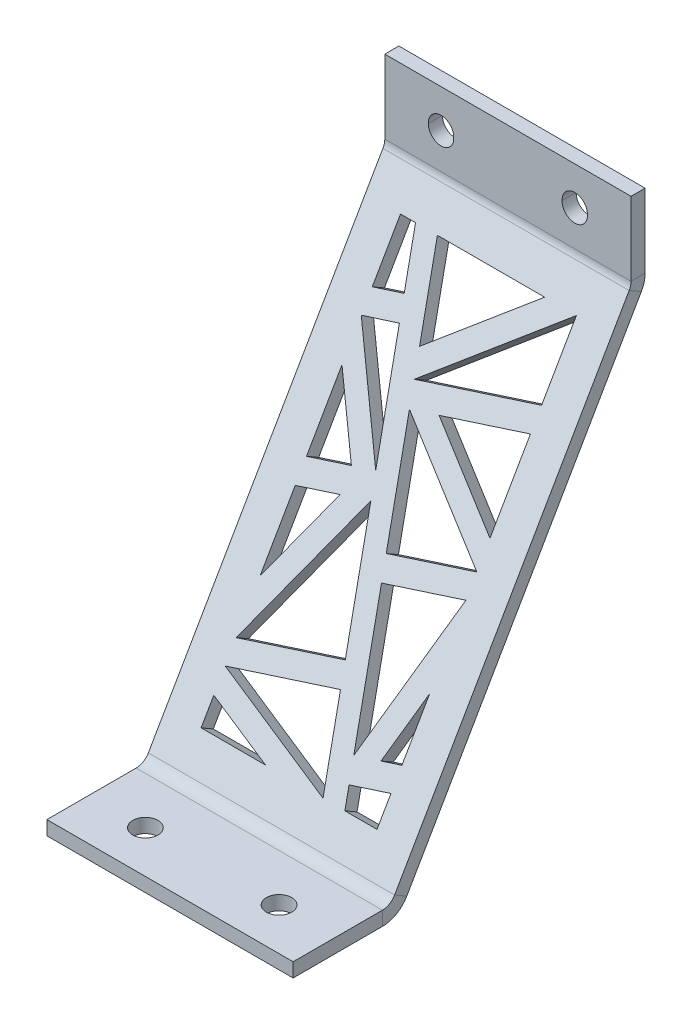
from build123d import *

# Parameters (mm, degrees)
SKETCH1_W            = 35
SKETCH1_H            = 15
BASE_FLANGE1_DEPTH   = 2
EDGE_FLANGE1_START   = -17.5
EDGE_FLANGE1_DEPTH   = 35
EDGE_FLANGE1_2_DEPTH = 35
EDGE_FLANGE2_START   = -17.5
EDGE_FLANGE2_DEPTH   = 35
EDGE_FLANGE2_2_DEPTH = 35
SKETCH8_W            = 25
SKETCH8_H            = 56.677305051
CUT_EXTRUDE1_DEPTH   = 10
BOSS_EXTRUDE1_DEPTH  = 2
BOSS_EXTRUDE2_DEPTH  = 2
M3_CLEARANCE_HOLE1_D = 3.6
M3_CLEARANCE_HOLE2_D = 3.6
M3_CLEARANCE_HOLE3_D = 3.6
M3_CLEARANCE_HOLE4_D = 3.6


# Read off the part's stored shape, not the designer's step: Edge-Flange1, Edge-Flange2
# Sheet-metal steps are written as plain solids
with BuildPart() as part:
    # Sketch1 → Base-Flange1 (new body)
    with BuildSketch(Plane.XY):
        Rectangle(SKETCH1_W, SKETCH1_H)
    extrude(amount=-BASE_FLANGE1_DEPTH)

    # Edge-Flange1 outline → Edge-Flange1 (cut)
    with BuildSketch(Plane.YZ.offset(EDGE_FLANGE1_START)):
        with BuildLine():
            ThreePointArc((-2.964101615, -2), (-3.999377795, -1.863703305), (-4.964101615, -1.464101615))
            Line((-4.964101615, -1.464101615), (-7.5, 0))
            Line((-7.5, 0), (-7.5, -2))
            Line((-7.5, -2), (-2.964101615, -2))
        make_face()
    extrude(amount=EDGE_FLANGE1_DEPTH, mode=Mode.SUBTRACT)

    # Edge-Flange1 2 outline → Edge-Flange1 2 (add)
    with BuildSketch(Plane.YZ.offset(EDGE_FLANGE1_START)):
        with BuildLine():
            Line((-65.708341645, 33.606601718), (-7.5, 0))
            Line((-7.5, 0), (-2.964101615, 0))
            ThreePointArc((-2.964101615, 0), (-3.481739705, 0.068148347), (-3.964101615, 0.267949192))
            Line((-3.964101615, 0.267949192), (-64.708341645, 35.338652525))
            Line((-64.708341645, 35.338652525), (-65.708341645, 33.606601718))
        make_face()
    extrude(amount=EDGE_FLANGE1_2_DEPTH)

    # Edge-Flange2 outline → Edge-Flange2 (cut)
    with BuildSketch(Plane.YZ.offset(EDGE_FLANGE2_START)):
        with BuildLine():
            ThreePointArc((-62.708341645, 31.87455091), (-64.17244326, 33.338652525), (-64.708341645, 35.338652525))
            Line((-64.708341645, 35.338652525), (-65.708341645, 33.606601718))
            Line((-65.708341645, 33.606601718), (-62.708341645, 31.87455091))
        make_face()
    extrude(amount=EDGE_FLANGE2_DEPTH, mode=Mode.SUBTRACT)

    # Edge-Flange2 2 outline → Edge-Flange2 2 (add)
    with BuildSketch(Plane.YZ.offset(EDGE_FLANGE2_START)):
        with BuildLine():
            Line((-64.708341645, 48.029251449), (-64.708341645, 35.338652525))
            Line((-64.708341645, 35.338652525), (-61.708341645, 33.606601718))
            ThreePointArc((-61.708341645, 33.606601718), (-62.440392453, 34.338652525), (-62.708341645, 35.338652525))
            Line((-62.708341645, 35.338652525), (-62.708341645, 48.029251449))
            Line((-62.708341645, 48.029251449), (-64.708341645, 48.029251449))
        make_face()
    extrude(amount=EDGE_FLANGE2_2_DEPTH)

    # Sketch8 → Cut-Extrude1 (cut)
    with BuildSketch(Plane(origin=(0, -0.875, -1.515544457), x_dir=(1, 0, 0), z_dir=(0, 0.499999999999995, 0.8660254037844416))):
        with Locations((0, -36.905639824)):
            Rectangle(SKETCH8_W, SKETCH8_H)
    extrude(amount=-CUT_EXTRUDE1_DEPTH, mode=Mode.SUBTRACT)

    # Sketch9 → Boss-Extrude1 (add)
    with BuildSketch(Plane(origin=(0, -0.875, -1.515544457), x_dir=(1, 0, 0), z_dir=(0, 0.499999999999995, 0.8660254037844416))):
        Polygon((8.83956854, -68.632858088), (7.246458748, -62.687291403), (15.857586038, -60.3799468), (15.081128903, -57.482169321), (6.470001613, -59.789513924), (1.919269462, -42.805950327), (15.365688048, -39.202993325), (14.946719777, -36.202993325), (1.14120391, -39.902170153), (-2.665166674, -25.696601742), (16.123001013, -20.662327383), (15.50761088, -17.662327383), (-3.456389996, -22.743716103), (-8.33426209, -4.539249615), (-11.232039569, -5.31570675), (-8.495960417, -15.52689316), (-17.05592393, -17.82052847), (-16.279466794, -20.718305949), (-7.708625485, -18.465267128), (-3.822054178, -32.970148713), (-15.793222539, -36.177813607), (-15.040127716, -39.177813607), (-3.021606391, -35.957460524), (1.177204702, -51.627636855), (-15.406874361, -56.071327447), (-14.947395895, -59.071327447), (1.957983923, -54.541544577), (5.941791061, -69.409315224), align=None)
    extrude(amount=-BOSS_EXTRUDE1_DEPTH)

    # Sketch10 → Boss-Extrude2 (add)
    with BuildSketch(Plane(origin=(0, -0.875, -1.515544457), x_dir=(1, 0, 0), z_dir=(0, 0.499999999999995, 0.8660254037844416))):
        Polygon((-3.456389996, -22.743716103), (12.5, -8.566987298), (10.507436864, -6.324289782), (-5.448953132, -20.501018587), align=None)
        Polygon((-2.665166674, -25.696601742), (12.5, -36.858589914), (14.278322137, -34.442483464), (-0.886844536, -23.280495293), align=None)
        Polygon((-3.822054178, -32.970148713), (-12.5, -19.724787915), (-15.00938766, -21.368860167), (-6.331441838, -34.614220965), align=None)
        Polygon((-12.5, -55.29243281), (-3.021606391, -35.957460524), (-5.715342898, -34.636936526), (-15.193736507, -53.971908812), align=None)
        Polygon((6.470001613, -59.789513924), (12.5, -39.970852124), (15.37009296, -40.844102603), (9.340094573, -60.662764404), align=None)
        Polygon((-12.5, -58.415549694), (4.825776546, -65.244292349), (3.725723751, -68.035328689), (-13.600052794, -61.206586033), align=None)
    extrude(amount=-BOSS_EXTRUDE2_DEPTH)

    # M3 Clearance Hole1 (through all)
    with Locations(Plane(origin=(-15.830402425, -63.569767603, -87), x_dir=(-1, 0, 0), z_dir=(0, 0, -1))):
        with Locations((-25.330402425, 65.569767603), (-6.330402425, 65.739876607)):
            Hole(M3_CLEARANCE_HOLE1_D / 2)

    # M3 Clearance Hole2 (through all)
    with Locations(Plane(origin=(15.830402425, -63.569767603, 0), x_dir=(1, 0, 0), z_dir=(0, 0, 1))):
        with Locations((-25.330402425, 65.569767603), (-6.330402425, 65.739876607)):
            Hole(M3_CLEARANCE_HOLE2_D / 2)

    # M3 Clearance Hole3 (through all)
    with Locations(Plane(origin=(15.830402425, -62.708341645, 22.375161803), x_dir=(-1, 0, 0), z_dir=(0, 1, 0))):
        with Locations((25.330402425, 19.654089646), (6.330402425, 19.654089646)):
            Hole(M3_CLEARANCE_HOLE3_D / 2)

    # M3 Clearance Hole4 (through all)
    with Locations(Plane(origin=(-15.830402425, -62.708341645, -109.375161803), x_dir=(1, 0, 0), z_dir=(0, 1, 0))):
        with Locations((25.330402425, -151.404413252), (6.330402425, -151.404413252)):
            Hole(M3_CLEARANCE_HOLE4_D / 2)


solid = part.part
